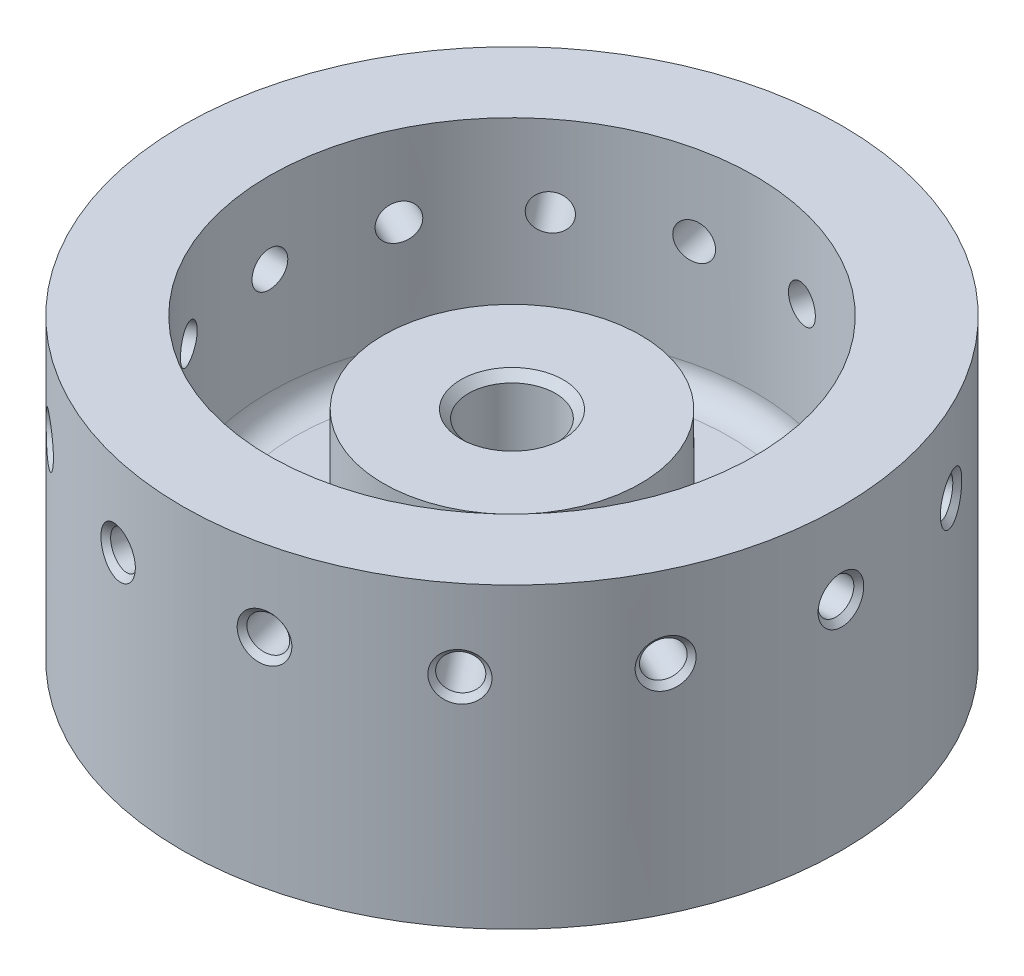
from build123d import *

# Parameters (mm, degrees)
M12_TAPPED_HOLE1_D           = 10.2
M12_TAPPED_HOLE1_DEPTH       = 20
M12_TAPPED_HOLE1_CSINK_D     = 12.05
M12_TAPPED_HOLE1_CSINK_ANGLE = 90
M12_TAPPED_HOLE1_TIP         = 3.064389157
FILLET1_R                    = 3
CIRPATTERN1_COUNT            = 14


# Read off the part's stored shape, not the designer's step: M5 Tapped Hole1
with BuildPart() as part:
    # Sketch1 → Revolve1 (revolve)
    with BuildSketch(Plane.XY, mode=Mode.PRIVATE) as revolve1_sk:
        Polygon((0, 0), (38.71, 0), (38.71, 35), (28.5, 35), (28.5, 10), (15.1, 10), (15.1, 25.5), (0, 25.5), align=None)
    revolve(revolve1_sk.sketch.rotate(Axis((0, 0, 0), (0, -1, 0)), 180), axis=Axis((0, 0, 0), (0, -1, 0)))

    # M12 Tapped Hole1
    with Locations(Plane(origin=(0, 25.5, 0), x_dir=(1, 0, 0), z_dir=(0, 1, 0))):
        with Locations((0, 0)):
            CounterSinkHole(M12_TAPPED_HOLE1_D / 2, M12_TAPPED_HOLE1_CSINK_D / 2, depth=M12_TAPPED_HOLE1_DEPTH, counter_sink_angle=M12_TAPPED_HOLE1_CSINK_ANGLE)
            with Locations((0, 0, -(M12_TAPPED_HOLE1_DEPTH + M12_TAPPED_HOLE1_TIP / 2))):  # 118° drill point
                Cone(0, M12_TAPPED_HOLE1_D / 2, M12_TAPPED_HOLE1_TIP, mode=Mode.SUBTRACT)

    # Fillet1
    fillet1_edges = [part.edges().sort_by_distance(p)[0] for p in [
        (15.1, 10, 0),
        (28.5, 10, 0),
    ]]
    fillet(fillet1_edges, radius=FILLET1_R)

    # M5 Tapped Hole1 outline → M5 Tapped Hole1 (revolve, cut)
    with BuildSketch(Plane(origin=(0, 25.5, 0), x_dir=(0, 1, 0), z_dir=(0, 0, -1))):
        Polygon((0, -38.710000355), (2.775000355, -38.710000355), (2.1, -38.035), (2.1, -28.422493026), (0, -28.422493026), align=None)
    m5_tapped_hole1 = revolve(axis=Axis((0, 25.5, 0), (1, 0, 0)), mode=Mode.SUBTRACT)

    # CirPattern1: M5 Tapped Hole1 ×14 about axis
    cirpattern1_axis = Axis((0, 0, 0), (0, 1, 0))
    for i in range(1, CIRPATTERN1_COUNT):
        add(m5_tapped_hole1.rotate(cirpattern1_axis, i * 360 / CIRPATTERN1_COUNT), mode=Mode.SUBTRACT)


solid = part.part
